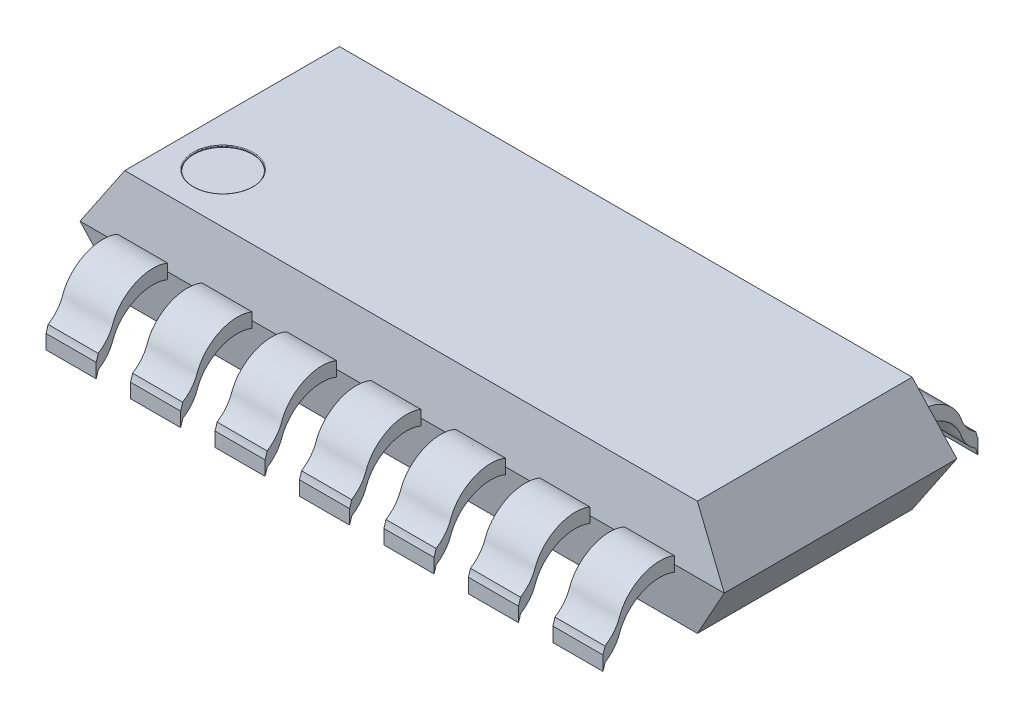
from build123d import *

# Parameters (mm, degrees)
ESQUISSE4_R                = 0.409241739
ENL_V_MAT_EXTRU_1_DEPTH    = 0.02
CONG_1_R                   = 0.01
LISSAGE3_START             = 3.1
LISSAGE3_DEPTH             = 0.7
R_P_TITION_LIN_AIRE1_COUNT = 7
R_P_TITION_LIN_AIRE1_PITCH = 1.18
SYM_TRIE2_START            = 3.1
SYM_TRIE2_COPY_1_DEPTH     = 0.7
SYM_TRIE2_COPY_2_DEPTH     = 0.7
SYM_TRIE2_COPY_3_DEPTH     = 0.7
SYM_TRIE2_COPY_4_DEPTH     = 0.7
SYM_TRIE2_COPY_5_DEPTH     = 0.7
SYM_TRIE2_COPY_6_DEPTH     = 0.7


# Read off the part's stored shape, not the designer's step: Lissage3
with BuildPart() as part:
    # Esquisse2 → Lissage1 section 0
    with BuildSketch(Plane(origin=(0, -0.8, 0), x_dir=(1, 0, 0), z_dir=(0, 1, 0))):
        with BuildLine():
            Line((4, -1.5), (-4, -1.5))
            Line((-4, -1.5), (-4, 1.5))
            Line((-4, 1.5), (4, 1.5))
            Line((4, 1.5), (4, -1.5))
        make_face()
    # Esquisse1 → Lissage1 section 1
    with BuildSketch(Plane(origin=(0, 0, 0), x_dir=(1, 0, 0), z_dir=(0, 1, 0))):
        with BuildLine():
            Line((4.5, -1.625), (-4.5, -1.625))
            Line((-4.5, -1.625), (-4.5, 1.625))
            Line((-4.5, 1.625), (4.5, 1.625))
            Line((4.5, 1.625), (4.5, -1.625))
        make_face()
    lissage1 = loft()

    # Symétrie1: Lissage1 across plane
    add(lissage1.mirror(Plane.ZX))

    # Esquisse4 → Enlèv. mat.-Extru.1 (cut)
    with BuildSketch(Plane(origin=(0, 0.8, 0), x_dir=(1, 0, 0), z_dir=(0, 1, 0))):
        with Locations(Location((-3.325038068, -0.80132568, 0), (0, 0, 270))):
            Circle(ESQUISSE4_R)
    extrude(amount=-ENL_V_MAT_EXTRU_1_DEPTH, mode=Mode.SUBTRACT)

    # Congé1
    cong_1_edges = [part.edges().sort_by_distance(p)[0] for p in [
        (-3.325038068, 0.8, 0.392083941),
    ]]
    fillet(cong_1_edges, radius=CONG_1_R)

    # Lissage3 outline → Lissage3 (add)
    with BuildSketch(Plane.YZ.offset(LISSAGE3_START)):
        with BuildLine():
            add(Edge.make_bspline(
                [(-0.8, 2.62), (-0.769617966, 2.607816758), (-0.738349403, 2.598007639), (-0.706452418, 2.590653613)],
                knots=[0, 0, 0, 0, 0.070338749, 0.070338749, 0.070338749, 0.070338749], degree=3))
            add(Edge.make_bspline(
                [(-0.706452418, 2.590653613), (-0.647536003, 2.496038721), (-0.559425731, 2.423155303), (-0.150765141, 2.282002287), (0.026129046, 1.915378174), (-0.1, 1.62)],
                knots=[0.070338749, 0.070338749, 0.070338749, 0.070338749, 0.309843454, 0.309843454, 1, 1, 1, 1], degree=3))
            Line((-0.1, 1.62), (-0.032, 1.62))
            Line((-0.032, 1.62), (0, 1.625))
            Line((0, 1.625), (0.032, 1.62))
            Line((0.032, 1.62), (0.1, 1.62))
            add(Edge.make_bspline(
                [(-0.506452418, 2.590653613), (-0.447536003, 2.496038721), (-0.359425731, 2.423155303), (0.049234859, 2.282002287), (0.226129046, 1.915378174), (0.1, 1.62)],
                knots=[0.070338749, 0.070338749, 0.070338749, 0.070338749, 0.309843454, 0.309843454, 1, 1, 1, 1], degree=3))
            add(Edge.make_bspline(
                [(-0.6, 2.62), (-0.569617966, 2.607816758), (-0.538349403, 2.598007639), (-0.506452418, 2.590653613)],
                knots=[0, 0, 0, 0, 0.070338749, 0.070338749, 0.070338749, 0.070338749], degree=3))
            Line((-0.6, 2.62), (-0.8, 2.62))
        make_face()
    lissage3 = extrude(amount=LISSAGE3_DEPTH)

    # Répétition linéaire1: Lissage3 ×7
    with Locations(*[(-i * R_P_TITION_LIN_AIRE1_PITCH, 0, 0) for i in range(1, R_P_TITION_LIN_AIRE1_COUNT)]):
        add(lissage3)

    # Symétrie2: Lissage3 across plane
    add(lissage3.mirror(Plane.XY))

    # Symétrie2 copy 1 sketch → Symétrie2 copy 1 (add)
    with BuildSketch(Plane.YZ.offset(-1.18).offset(SYM_TRIE2_START)):
        with BuildLine():
            add(Edge.make_bspline(
                [(-0.8, -2.62), (-0.769617966, -2.607816758), (-0.738349403, -2.598007639), (-0.706452418, -2.590653613)],
                knots=[0, 0, 0, 0, 0.070338749, 0.070338749, 0.070338749, 0.070338749], degree=3))
            add(Edge.make_bspline(
                [(-0.706452418, -2.590653613), (-0.647536003, -2.496038721), (-0.559425731, -2.423155303), (-0.150765141, -2.282002287), (0.026129046, -1.915378174), (-0.1, -1.62)],
                knots=[0.070338749, 0.070338749, 0.070338749, 0.070338749, 0.309843454, 0.309843454, 1, 1, 1, 1], degree=3))
            Line((-0.1, -1.62), (-0.032, -1.62))
            Line((-0.032, -1.62), (0, -1.625))
            Line((0, -1.625), (0.032, -1.62))
            Line((0.032, -1.62), (0.1, -1.62))
            add(Edge.make_bspline(
                [(-0.506452418, -2.590653613), (-0.447536003, -2.496038721), (-0.359425731, -2.423155303), (0.049234859, -2.282002287), (0.226129046, -1.915378174), (0.1, -1.62)],
                knots=[0.070338749, 0.070338749, 0.070338749, 0.070338749, 0.309843454, 0.309843454, 1, 1, 1, 1], degree=3))
            add(Edge.make_bspline(
                [(-0.6, -2.62), (-0.569617966, -2.607816758), (-0.538349403, -2.598007639), (-0.506452418, -2.590653613)],
                knots=[0, 0, 0, 0, 0.070338749, 0.070338749, 0.070338749, 0.070338749], degree=3))
            Line((-0.6, -2.62), (-0.8, -2.62))
        make_face()
    extrude(amount=SYM_TRIE2_COPY_1_DEPTH)

    # Symétrie2 copy 2 sketch → Symétrie2 copy 2 (add)
    with BuildSketch(Plane.YZ.offset(-2.36).offset(SYM_TRIE2_START)):
        with BuildLine():
            add(Edge.make_bspline(
                [(-0.8, -2.62), (-0.769617966, -2.607816758), (-0.738349403, -2.598007639), (-0.706452418, -2.590653613)],
                knots=[0, 0, 0, 0, 0.070338749, 0.070338749, 0.070338749, 0.070338749], degree=3))
            add(Edge.make_bspline(
                [(-0.706452418, -2.590653613), (-0.647536003, -2.496038721), (-0.559425731, -2.423155303), (-0.150765141, -2.282002287), (0.026129046, -1.915378174), (-0.1, -1.62)],
                knots=[0.070338749, 0.070338749, 0.070338749, 0.070338749, 0.309843454, 0.309843454, 1, 1, 1, 1], degree=3))
            Line((-0.1, -1.62), (-0.032, -1.62))
            Line((-0.032, -1.62), (0, -1.625))
            Line((0, -1.625), (0.032, -1.62))
            Line((0.032, -1.62), (0.1, -1.62))
            add(Edge.make_bspline(
                [(-0.506452418, -2.590653613), (-0.447536003, -2.496038721), (-0.359425731, -2.423155303), (0.049234859, -2.282002287), (0.226129046, -1.915378174), (0.1, -1.62)],
                knots=[0.070338749, 0.070338749, 0.070338749, 0.070338749, 0.309843454, 0.309843454, 1, 1, 1, 1], degree=3))
            add(Edge.make_bspline(
                [(-0.6, -2.62), (-0.569617966, -2.607816758), (-0.538349403, -2.598007639), (-0.506452418, -2.590653613)],
                knots=[0, 0, 0, 0, 0.070338749, 0.070338749, 0.070338749, 0.070338749], degree=3))
            Line((-0.6, -2.62), (-0.8, -2.62))
        make_face()
    extrude(amount=SYM_TRIE2_COPY_2_DEPTH)

    # Symétrie2 copy 3 sketch → Symétrie2 copy 3 (add)
    with BuildSketch(Plane.YZ.offset(-3.54).offset(SYM_TRIE2_START)):
        with BuildLine():
            add(Edge.make_bspline(
                [(-0.8, -2.62), (-0.769617966, -2.607816758), (-0.738349403, -2.598007639), (-0.706452418, -2.590653613)],
                knots=[0, 0, 0, 0, 0.070338749, 0.070338749, 0.070338749, 0.070338749], degree=3))
            add(Edge.make_bspline(
                [(-0.706452418, -2.590653613), (-0.647536003, -2.496038721), (-0.559425731, -2.423155303), (-0.150765141, -2.282002287), (0.026129046, -1.915378174), (-0.1, -1.62)],
                knots=[0.070338749, 0.070338749, 0.070338749, 0.070338749, 0.309843454, 0.309843454, 1, 1, 1, 1], degree=3))
            Line((-0.1, -1.62), (-0.032, -1.62))
            Line((-0.032, -1.62), (0, -1.625))
            Line((0, -1.625), (0.032, -1.62))
            Line((0.032, -1.62), (0.1, -1.62))
            add(Edge.make_bspline(
                [(-0.506452418, -2.590653613), (-0.447536003, -2.496038721), (-0.359425731, -2.423155303), (0.049234859, -2.282002287), (0.226129046, -1.915378174), (0.1, -1.62)],
                knots=[0.070338749, 0.070338749, 0.070338749, 0.070338749, 0.309843454, 0.309843454, 1, 1, 1, 1], degree=3))
            add(Edge.make_bspline(
                [(-0.6, -2.62), (-0.569617966, -2.607816758), (-0.538349403, -2.598007639), (-0.506452418, -2.590653613)],
                knots=[0, 0, 0, 0, 0.070338749, 0.070338749, 0.070338749, 0.070338749], degree=3))
            Line((-0.6, -2.62), (-0.8, -2.62))
        make_face()
    extrude(amount=SYM_TRIE2_COPY_3_DEPTH)

    # Symétrie2 copy 4 sketch → Symétrie2 copy 4 (add)
    with BuildSketch(Plane.YZ.offset(-4.72).offset(SYM_TRIE2_START)):
        with BuildLine():
            add(Edge.make_bspline(
                [(-0.8, -2.62), (-0.769617966, -2.607816758), (-0.738349403, -2.598007639), (-0.706452418, -2.590653613)],
                knots=[0, 0, 0, 0, 0.070338749, 0.070338749, 0.070338749, 0.070338749], degree=3))
            add(Edge.make_bspline(
                [(-0.706452418, -2.590653613), (-0.647536003, -2.496038721), (-0.559425731, -2.423155303), (-0.150765141, -2.282002287), (0.026129046, -1.915378174), (-0.1, -1.62)],
                knots=[0.070338749, 0.070338749, 0.070338749, 0.070338749, 0.309843454, 0.309843454, 1, 1, 1, 1], degree=3))
            Line((-0.1, -1.62), (-0.032, -1.62))
            Line((-0.032, -1.62), (0, -1.625))
            Line((0, -1.625), (0.032, -1.62))
            Line((0.032, -1.62), (0.1, -1.62))
            add(Edge.make_bspline(
                [(-0.506452418, -2.590653613), (-0.447536003, -2.496038721), (-0.359425731, -2.423155303), (0.049234859, -2.282002287), (0.226129046, -1.915378174), (0.1, -1.62)],
                knots=[0.070338749, 0.070338749, 0.070338749, 0.070338749, 0.309843454, 0.309843454, 1, 1, 1, 1], degree=3))
            add(Edge.make_bspline(
                [(-0.6, -2.62), (-0.569617966, -2.607816758), (-0.538349403, -2.598007639), (-0.506452418, -2.590653613)],
                knots=[0, 0, 0, 0, 0.070338749, 0.070338749, 0.070338749, 0.070338749], degree=3))
            Line((-0.6, -2.62), (-0.8, -2.62))
        make_face()
    extrude(amount=SYM_TRIE2_COPY_4_DEPTH)

    # Symétrie2 copy 5 sketch → Symétrie2 copy 5 (add)
    with BuildSketch(Plane.YZ.offset(-5.9).offset(SYM_TRIE2_START)):
        with BuildLine():
            add(Edge.make_bspline(
                [(-0.8, -2.62), (-0.769617966, -2.607816758), (-0.738349403, -2.598007639), (-0.706452418, -2.590653613)],
                knots=[0, 0, 0, 0, 0.070338749, 0.070338749, 0.070338749, 0.070338749], degree=3))
            add(Edge.make_bspline(
                [(-0.706452418, -2.590653613), (-0.647536003, -2.496038721), (-0.559425731, -2.423155303), (-0.150765141, -2.282002287), (0.026129046, -1.915378174), (-0.1, -1.62)],
                knots=[0.070338749, 0.070338749, 0.070338749, 0.070338749, 0.309843454, 0.309843454, 1, 1, 1, 1], degree=3))
            Line((-0.1, -1.62), (-0.032, -1.62))
            Line((-0.032, -1.62), (0, -1.625))
            Line((0, -1.625), (0.032, -1.62))
            Line((0.032, -1.62), (0.1, -1.62))
            add(Edge.make_bspline(
                [(-0.506452418, -2.590653613), (-0.447536003, -2.496038721), (-0.359425731, -2.423155303), (0.049234859, -2.282002287), (0.226129046, -1.915378174), (0.1, -1.62)],
                knots=[0.070338749, 0.070338749, 0.070338749, 0.070338749, 0.309843454, 0.309843454, 1, 1, 1, 1], degree=3))
            add(Edge.make_bspline(
                [(-0.6, -2.62), (-0.569617966, -2.607816758), (-0.538349403, -2.598007639), (-0.506452418, -2.590653613)],
                knots=[0, 0, 0, 0, 0.070338749, 0.070338749, 0.070338749, 0.070338749], degree=3))
            Line((-0.6, -2.62), (-0.8, -2.62))
        make_face()
    extrude(amount=SYM_TRIE2_COPY_5_DEPTH)

    # Symétrie2 copy 6 sketch → Symétrie2 copy 6 (add)
    with BuildSketch(Plane.YZ.offset(-7.08).offset(SYM_TRIE2_START)):
        with BuildLine():
            add(Edge.make_bspline(
                [(-0.8, -2.62), (-0.769617966, -2.607816758), (-0.738349403, -2.598007639), (-0.706452418, -2.590653613)],
                knots=[0, 0, 0, 0, 0.070338749, 0.070338749, 0.070338749, 0.070338749], degree=3))
            add(Edge.make_bspline(
                [(-0.706452418, -2.590653613), (-0.647536003, -2.496038721), (-0.559425731, -2.423155303), (-0.150765141, -2.282002287), (0.026129046, -1.915378174), (-0.1, -1.62)],
                knots=[0.070338749, 0.070338749, 0.070338749, 0.070338749, 0.309843454, 0.309843454, 1, 1, 1, 1], degree=3))
            Line((-0.1, -1.62), (-0.032, -1.62))
            Line((-0.032, -1.62), (0, -1.625))
            Line((0, -1.625), (0.032, -1.62))
            Line((0.032, -1.62), (0.1, -1.62))
            add(Edge.make_bspline(
                [(-0.506452418, -2.590653613), (-0.447536003, -2.496038721), (-0.359425731, -2.423155303), (0.049234859, -2.282002287), (0.226129046, -1.915378174), (0.1, -1.62)],
                knots=[0.070338749, 0.070338749, 0.070338749, 0.070338749, 0.309843454, 0.309843454, 1, 1, 1, 1], degree=3))
            add(Edge.make_bspline(
                [(-0.6, -2.62), (-0.569617966, -2.607816758), (-0.538349403, -2.598007639), (-0.506452418, -2.590653613)],
                knots=[0, 0, 0, 0, 0.070338749, 0.070338749, 0.070338749, 0.070338749], degree=3))
            Line((-0.6, -2.62), (-0.8, -2.62))
        make_face()
    extrude(amount=SYM_TRIE2_COPY_6_DEPTH)


solid = part.part
